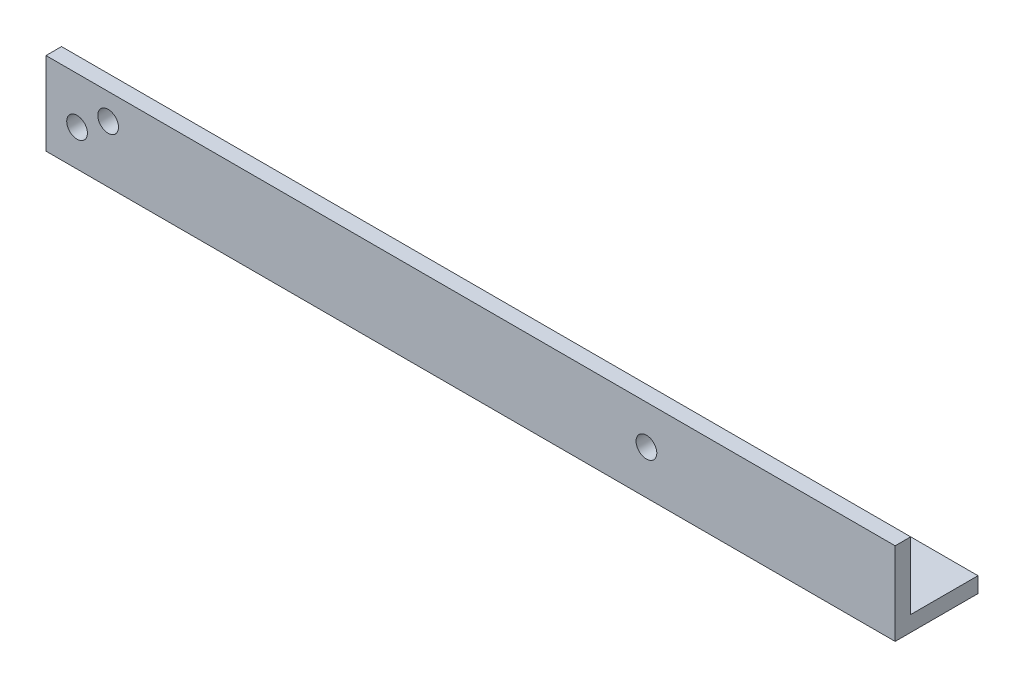
from build123d import *

# Parameters (mm, degrees)
BOSS_EXTRUDE1_DEPTH = 260.35
CUT_EXTRUDE1_REACH  = 264.399
SKETCH3_R           = 3.175
CUT_EXTRUDE2_REACH  = 264.816
SKETCH4_R           = 3.175
CUT_EXTRUDE4_REACH  = 264.816
SKETCH5_R           = 3.175


with BuildPart() as part:
    # Sketch1 → Boss-Extrude1 (new body)
    with BuildSketch(Plane(origin=(0, 0, 0), x_dir=(0, 0, -1), z_dir=(1, 0, 0))):
        Polygon((0, 0), (0, -25.4), (25.4, -25.4), (25.4, -20.6375), (4.7625, -20.6375), (4.7625, 0), align=None)
    extrude(amount=BOSS_EXTRUDE1_DEPTH)

    # Sketch3 → Cut-Extrude1 (cut, up to next)
    with BuildSketch(Plane(origin=(0, 0, -4.7625), x_dir=(-1, 0, 0), z_dir=(0, 0, -1)), mode=Mode.PRIVATE) as cut_extrude1_sk1:
        with Locations((-9.525, -14.2875)):
            Circle(SKETCH3_R)
    cut_extrude1_tool1 = extrude(cut_extrude1_sk1.sketch, amount=-CUT_EXTRUDE1_REACH, mode=Mode.PRIVATE) & part.part
    # Sketch3 → Cut-Extrude1 (cut, up to next)
    with BuildSketch(Plane(origin=(0, 0, -4.7625), x_dir=(-1, 0, 0), z_dir=(0, 0, -1)), mode=Mode.PRIVATE) as cut_extrude1_sk2:
        with Locations((-19.05, -7.9375)):
            Circle(SKETCH3_R)
    cut_extrude1_tool2 = extrude(cut_extrude1_sk2.sketch, amount=-CUT_EXTRUDE1_REACH, mode=Mode.PRIVATE) & part.part
    add(cut_extrude1_tool1.solids().sort_by_distance((9.525, -14.2875, -4.7625))[0], mode=Mode.SUBTRACT)
    add(cut_extrude1_tool2.solids().sort_by_distance((19.05, -7.9375, -4.7625))[0], mode=Mode.SUBTRACT)

    # Sketch4 → Cut-Extrude2 (cut, up to next)
    with BuildSketch(Plane.XY, mode=Mode.PRIVATE) as cut_extrude2_sk1:
        with Locations((184.095250482, -11.929615818)):
            Circle(SKETCH4_R)
    cut_extrude2_tool1 = extrude(cut_extrude2_sk1.sketch, amount=-CUT_EXTRUDE2_REACH, mode=Mode.PRIVATE) & part.part
    add(cut_extrude2_tool1.solids().sort_by_distance((184.09525, -11.929616, 0))[0], mode=Mode.SUBTRACT)

    # Sketch5 → Cut-Extrude4 (cut, up to next)
    with BuildSketch(Plane.XZ.offset(25.4), mode=Mode.PRIVATE) as cut_extrude4_sk1:
        with Locations((222.25, -12.7)):
            Circle(SKETCH5_R)
    cut_extrude4_tool1 = extrude(cut_extrude4_sk1.sketch, amount=-CUT_EXTRUDE4_REACH, mode=Mode.PRIVATE) & part.part
    # Sketch5 → Cut-Extrude4 (cut, up to next)
    with BuildSketch(Plane.XZ.offset(25.4), mode=Mode.PRIVATE) as cut_extrude4_sk2:
        with Locations((247.65, -12.7)):
            Circle(SKETCH5_R)
    cut_extrude4_tool2 = extrude(cut_extrude4_sk2.sketch, amount=-CUT_EXTRUDE4_REACH, mode=Mode.PRIVATE) & part.part
    add(cut_extrude4_tool1.solids().sort_by_distance((222.25, -25.4, -12.7))[0], mode=Mode.SUBTRACT)
    add(cut_extrude4_tool2.solids().sort_by_distance((247.65, -25.4, -12.7))[0], mode=Mode.SUBTRACT)


solid = part.part
